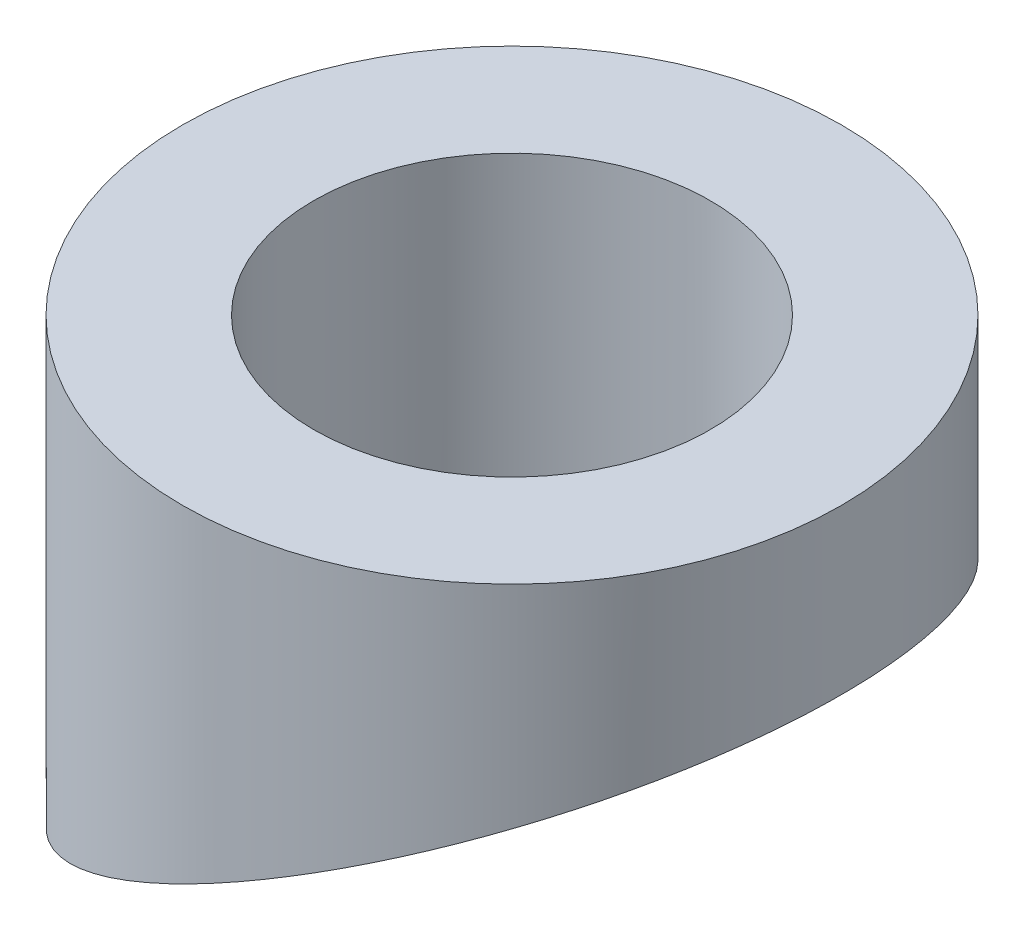
from build123d import *

# Parameters (mm, degrees)
SKETCH1_R           = 10.05
SKETCH1_R_2         = 6.05
BOSS_EXTRUDE1_DEPTH = 15
CUT_EXTRUDE1_DEPTH  = 15


with BuildPart() as part:
    # Sketch1 → Boss-Extrude1 (new body)
    with BuildSketch(Plane(origin=(0, 0, 0), x_dir=(1, 0, 0), z_dir=(0, 1, 0))):
        Circle(SKETCH1_R)
        Circle(SKETCH1_R_2, mode=Mode.SUBTRACT)
    extrude(amount=BOSS_EXTRUDE1_DEPTH)

    # Sketch3 → Cut-Extrude1 (cut, symmetric)
    with BuildSketch(Plane.XY):
        Polygon((-10.05, 0), (10.05, 10), (10.05, 0), align=None)
    extrude(amount=CUT_EXTRUDE1_DEPTH, both=True, mode=Mode.SUBTRACT)


solid = part.part
